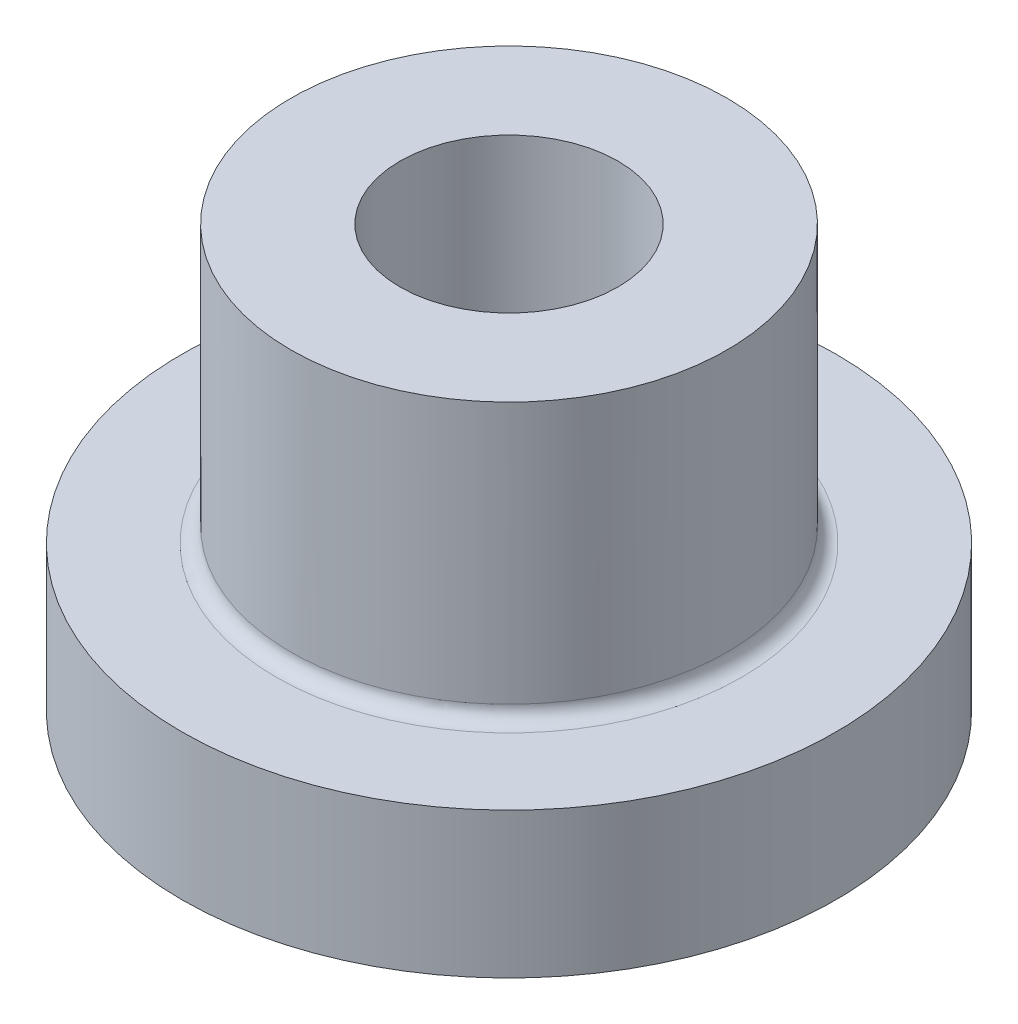
from build123d import *

# Parameters (mm, degrees)
SKETCH1_R                = 3
BOSS_EXTRUDE1_DEPTH      = 4.2
SHELL1_T                 = -1.5
BOSS_EXTRUDE2_DEPTH      = 1.6
BOSS_EXTRUDE2_DEPTH_BACK = 0.4
SKETCH2_R                = 4.5
SKETCH2_R_2              = 3
FILLET4_R                = 0.2


with BuildPart() as part:
    # Sketch1 → Boss-Extrude1 (new body)
    with BuildSketch(Plane(origin=(0, 0, 0), x_dir=(1, 0, 0), z_dir=(0, 1, 0))):
        Circle(SKETCH1_R)
    extrude(amount=BOSS_EXTRUDE1_DEPTH)

    # Shell1
    shell1_openings = [part.faces().sort_by_distance(p)[0] for p in [
        (0, 0, 0),
        (0, 4.2, 0),
    ]]
    offset(amount=SHELL1_T, openings=shell1_openings, kind=Kind.INTERSECTION)

    # Sketch2 → Boss-Extrude2 (add, two sides: drawn at the far end of the back side and taken through both)
    with BuildSketch(Plane.XZ.offset(-BOSS_EXTRUDE2_DEPTH_BACK)):
        Circle(SKETCH2_R)
        Circle(SKETCH2_R_2, mode=Mode.SUBTRACT)
    extrude(amount=BOSS_EXTRUDE2_DEPTH + BOSS_EXTRUDE2_DEPTH_BACK)

    # Fillet4
    fillet4_edges = [part.edges().sort_by_distance(p)[0] for p in [
        (-3, 0, 0),
        (-3, 0.4, 0),
    ]]
    fillet(fillet4_edges, radius=FILLET4_R)


solid = part.part
